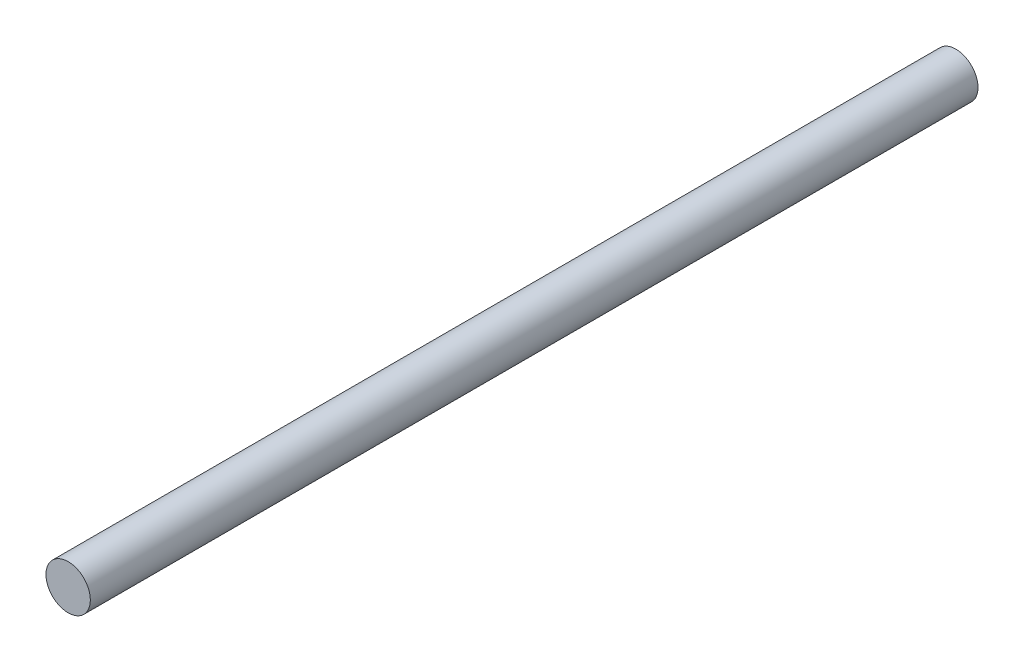
from build123d import *

# Parameters (mm, degrees)
SKETCH1_R           = 2.5
BOSS_EXTRUDE1_DEPTH = 100


with BuildPart() as part:
    # Sketch1 → Boss-Extrude1 (new body)
    with BuildSketch(Plane.XY):
        Circle(SKETCH1_R)
    extrude(amount=BOSS_EXTRUDE1_DEPTH)


solid = part.part
